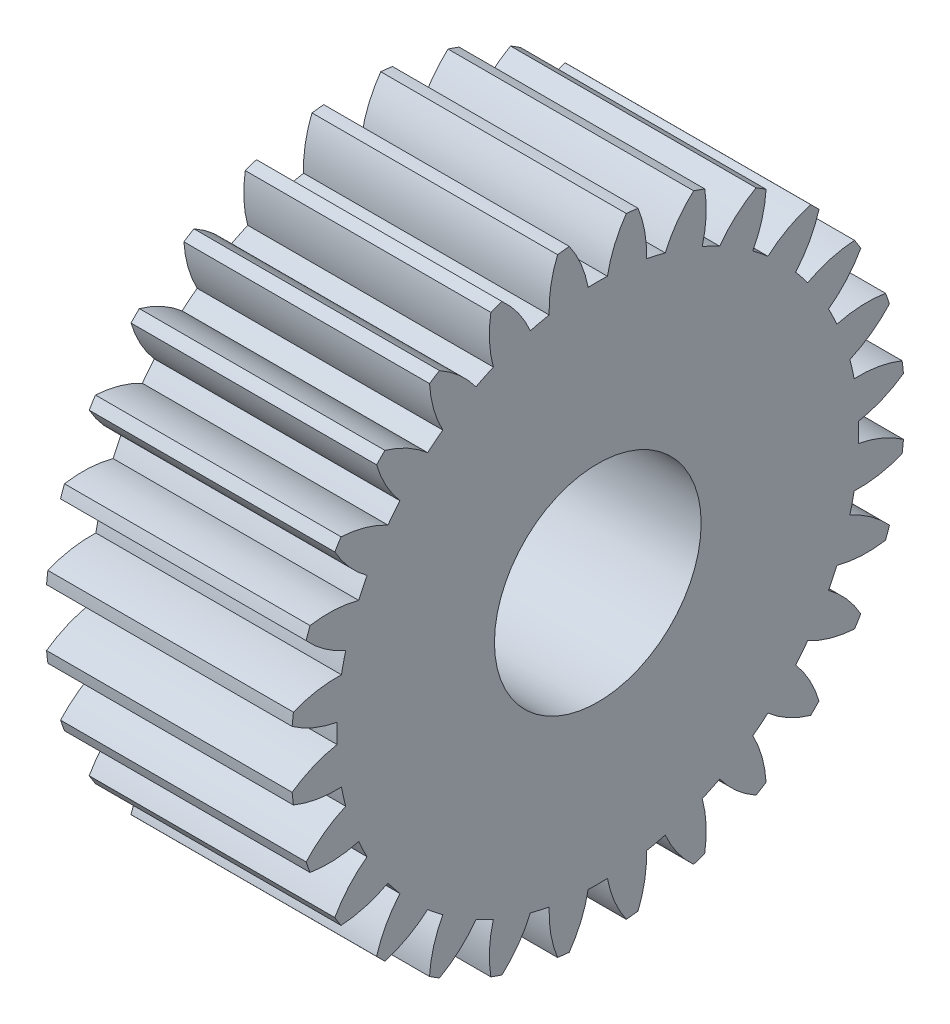
from build123d import *

# Parameters (mm, degrees)
SPUR_START             = -21.136062357
SPUR_GEAR_AM_OUTLINE_R = 1.5
SPUR_GEAR_AM_DEPTH     = 12
SKETCH1_R              = 5.05
CUT_EXTRUDE1_DEPTH     = 20


# Read off the part's stored shape, not the designer's step: spur gear_am
with BuildPart() as part:
    # spur gear_am outline → spur gear_am (new body)
    with BuildSketch(Plane.YZ.offset(SPUR_START)):
        with BuildLine():
            ThreePointArc((13.80407966, 17.98086417), (13.518158302, 18.015863136), (13.231617587, 18.045365155))
            ThreePointArc((13.231617587, 18.045365155), (12.652844511, 16.997451013), (12.310027199, 15.85046426))
            ThreePointArc((12.310027199, 15.85046426), (11.83869116, 15.859179988), (11.367355122, 15.85046426))
            ThreePointArc((11.367355122, 15.85046426), (11.02453781, 16.997451013), (10.445764734, 18.045365155))
            ThreePointArc((10.445764734, 18.045365155), (10.159224019, 18.015863136), (9.873302662, 17.98086417))
            ThreePointArc((9.873302662, 17.98086417), (9.542223468, 16.830434298), (9.463229866, 15.635920869))
            ThreePointArc((9.463229866, 15.635920869), (9.001771774, 15.53953594), (8.544192545, 15.426156598))
            ThreePointArc((8.544192545, 15.426156598), (7.954741816, 16.468101971), (7.157296955, 17.360953591))
            ThreePointArc((7.157296955, 17.360953591), (6.884505231, 17.268429942), (6.613540522, 17.170684986))
            ThreePointArc((6.613540522, 17.170684986), (6.546756904, 15.975426742), (6.73554808, 14.793284528))
            ThreePointArc((6.73554808, 14.793284528), (6.30710737, 14.596632085), (5.886229886, 14.384274442))
            ThreePointArc((5.886229886, 14.384274442), (5.07970326, 15.268930942), (4.10357383, 15.961948733))
            ThreePointArc((4.10357383, 15.961948733), (3.858210013, 15.811042976), (3.615789253, 15.655453369))
            ThreePointArc((3.615789253, 15.655453369), (3.816650021, 14.475301992), (4.263759198, 13.364808541))
            ThreePointArc((4.263759198, 13.364808541), (3.889819677, 13.077749558), (3.52674849, 12.777062114))
            ThreePointArc((3.52674849, 12.777062114), (2.54358858, 13.46006937), (1.437721787, 13.918502526))
            ThreePointArc((1.437721787, 13.918502526), (1.232089443, 13.716781705), (1.030368622, 13.511149361))
            ThreePointArc((1.030368622, 13.511149361), (1.488801778, 12.405282568), (2.171809034, 11.422122658))
            ThreePointArc((2.171809034, 11.422122658), (1.87112159, 11.059051471), (1.584062607, 10.68511195))
            ThreePointArc((1.584062607, 10.68511195), (0.473569156, 11.132221127), (-0.706582221, 11.333081895))
            ThreePointArc((-0.706582221, 11.333081895), (-0.862171828, 11.090661135), (-1.013077585, 10.845297318))
            ThreePointArc((-1.013077585, 10.845297318), (-0.320059794, 9.869167889), (0.564596706, 9.062641262))
            ThreePointArc((0.564596706, 9.062641262), (0.352239064, 8.641763777), (0.15558662, 8.213323068))
            ThreePointArc((0.15558662, 8.213323068), (-1.026555594, 8.402114244), (-2.221813838, 8.335330626))
            ThreePointArc((-2.221813838, 8.335330626), (-2.319558794, 8.064365917), (-2.412082443, 7.791574193))
            ThreePointArc((-2.412082443, 7.791574193), (-1.519230823, 6.994129332), (-0.47728545, 6.404678603))
            ThreePointArc((-0.47728545, 6.404678603), (-0.590664792, 5.947099374), (-0.687049721, 5.485641282))
            ThreePointArc((-0.687049721, 5.485641282), (-1.88156315, 5.406647681), (-3.031993022, 5.075568487))
            ThreePointArc((-3.031993022, 5.075568487), (-3.066991988, 4.78964713), (-3.096494006, 4.503106415))
            ThreePointArc((-3.096494006, 4.503106415), (-2.048579865, 3.924333338), (-0.901593112, 3.581516027))
            ThreePointArc((-0.901593112, 3.581516027), (-0.910308839, 3.110179988), (-0.901593112, 2.638843949))
            ThreePointArc((-0.901593112, 2.638843949), (-2.048579865, 2.296026638), (-3.096494006, 1.717253561))
            ThreePointArc((-3.096494006, 1.717253561), (-3.066991988, 1.430712846), (-3.031993022, 1.144791489))
            ThreePointArc((-3.031993022, 1.144791489), (-1.88156315, 0.813712295), (-0.687049721, 0.734718693))
            ThreePointArc((-0.687049721, 0.734718693), (-0.590664792, 0.273260601), (-0.47728545, -0.184318628))
            ThreePointArc((-0.47728545, -0.184318628), (-1.519230823, -0.773769357), (-2.412082443, -1.571214218))
            ThreePointArc((-2.412082443, -1.571214218), (-2.319558794, -1.844005942), (-2.221813838, -2.114970651))
            ThreePointArc((-2.221813838, -2.114970651), (-1.026555594, -2.181754269), (0.15558662, -1.992963092))
            ThreePointArc((0.15558662, -1.992963092), (0.352239064, -2.421403802), (0.564596706, -2.842281287))
            ThreePointArc((0.564596706, -2.842281287), (-0.320059794, -3.648807913), (-1.013077585, -4.624937343))
            ThreePointArc((-1.013077585, -4.624937343), (-0.862171828, -4.87030116), (-0.706582221, -5.11272192))
            ThreePointArc((-0.706582221, -5.11272192), (0.473569156, -4.911861152), (1.584062607, -4.464751975))
            ThreePointArc((1.584062607, -4.464751975), (1.871121591, -4.838691496), (2.171809034, -5.201762683))
            ThreePointArc((2.171809034, -5.201762683), (1.488801778, -6.184922593), (1.030368622, -7.290789386))
            ThreePointArc((1.030368622, -7.290789386), (1.232089443, -7.49642173), (1.437721787, -7.69814255))
            ThreePointArc((1.437721787, -7.69814255), (2.54358858, -7.239709395), (3.52674849, -6.556702139))
            ThreePointArc((3.52674849, -6.556702139), (3.889819677, -6.857389582), (4.263759198, -7.144448565))
            ThreePointArc((4.263759198, -7.144448565), (3.816650021, -8.254942017), (3.615789253, -9.435093394))
            ThreePointArc((3.615789253, -9.435093394), (3.858210013, -9.590683001), (4.10357383, -9.741588758))
            ThreePointArc((4.10357383, -9.741588758), (5.07970326, -9.048570967), (5.886229886, -8.163914467))
            ThreePointArc((5.886229886, -8.163914467), (6.307107371, -8.376272109), (6.73554808, -8.572924553))
            ThreePointArc((6.73554808, -8.572924553), (6.546756904, -9.755066766), (6.613540522, -10.95032501))
            ThreePointArc((6.613540522, -10.95032501), (6.884505231, -11.048069967), (7.157296955, -11.140593616))
            ThreePointArc((7.157296955, -11.140593616), (7.954741816, -10.247741996), (8.544192545, -9.205796623))
            ThreePointArc((8.544192545, -9.205796623), (9.001771774, -9.319175965), (9.463229866, -9.415560894))
            ThreePointArc((9.463229866, -9.415560894), (9.542223468, -10.610074323), (9.873302662, -11.760504195))
            ThreePointArc((9.873302662, -11.760504195), (10.159224019, -11.795503161), (10.445764734, -11.825005179))
            ThreePointArc((10.445764734, -11.825005179), (11.02453781, -10.777091038), (11.367355122, -9.630104285))
            ThreePointArc((11.367355122, -9.630104285), (11.83869116, -9.638820012), (12.310027199, -9.630104285))
            ThreePointArc((12.310027199, -9.630104285), (12.652844511, -10.777091038), (13.231617587, -11.825005179))
            ThreePointArc((13.231617587, -11.825005179), (13.518158302, -11.795503161), (13.80407966, -11.760504195))
            ThreePointArc((13.80407966, -11.760504195), (14.135158854, -10.610074323), (14.214152455, -9.415560894))
            ThreePointArc((14.214152455, -9.415560894), (14.675610547, -9.319175965), (15.133189776, -9.205796623))
            ThreePointArc((15.133189776, -9.205796623), (15.722640505, -10.247741996), (16.520085366, -11.140593616))
            ThreePointArc((16.520085366, -11.140593616), (16.79287709, -11.048069967), (17.063841799, -10.95032501))
            ThreePointArc((17.063841799, -10.95032501), (17.130625417, -9.755066766), (16.941834241, -8.572924553))
            ThreePointArc((16.941834241, -8.572924553), (17.37027495, -8.376272109), (17.791152435, -8.163914467))
            ThreePointArc((17.791152435, -8.163914467), (18.597679061, -9.048570967), (19.573808491, -9.741588758))
            ThreePointArc((19.573808491, -9.741588758), (19.819172308, -9.590683001), (20.061593068, -9.435093394))
            ThreePointArc((20.061593068, -9.435093394), (19.8607323, -8.254942017), (19.413623123, -7.144448565))
            ThreePointArc((19.413623123, -7.144448565), (19.787562644, -6.857389582), (20.150633831, -6.556702139))
            ThreePointArc((20.150633831, -6.556702139), (21.133793741, -7.239709395), (22.239660534, -7.69814255))
            ThreePointArc((22.239660534, -7.69814255), (22.445292878, -7.49642173), (22.647013699, -7.290789386))
            ThreePointArc((22.647013699, -7.290789386), (22.188580543, -6.184922593), (21.505573287, -5.201762683))
            ThreePointArc((21.505573287, -5.201762683), (21.806260731, -4.838691496), (22.093319714, -4.464751975))
            ThreePointArc((22.093319714, -4.464751975), (23.203813165, -4.911861152), (24.383964542, -5.11272192))
            ThreePointArc((24.383964542, -5.11272192), (24.539554149, -4.87030116), (24.690459906, -4.624937343))
            ThreePointArc((24.690459906, -4.624937343), (23.997442115, -3.648807913), (23.112785615, -2.842281287))
            ThreePointArc((23.112785615, -2.842281287), (23.325143257, -2.421403802), (23.521795701, -1.992963092))
            ThreePointArc((23.521795701, -1.992963092), (24.703937915, -2.181754269), (25.899196159, -2.114970651))
            ThreePointArc((25.899196159, -2.114970651), (25.996941115, -1.844005942), (26.089464764, -1.571214218))
            ThreePointArc((26.089464764, -1.571214218), (25.196613144, -0.773769357), (24.154667771, -0.184318628))
            ThreePointArc((24.154667771, -0.184318628), (24.268047113, 0.273260601), (24.364432042, 0.734718693))
            ThreePointArc((24.364432042, 0.734718693), (25.558945471, 0.813712295), (26.709375343, 1.144791489))
            ThreePointArc((26.709375343, 1.144791489), (26.744374309, 1.430712846), (26.773876327, 1.717253561))
            ThreePointArc((26.773876327, 1.717253561), (25.725962186, 2.296026638), (24.578975433, 2.638843949))
            ThreePointArc((24.578975433, 2.638843949), (24.587691161, 3.110179988), (24.578975433, 3.581516027))
            ThreePointArc((24.578975433, 3.581516027), (25.725962186, 3.924333338), (26.773876327, 4.503106415))
            ThreePointArc((26.773876327, 4.503106415), (26.744374309, 4.78964713), (26.709375343, 5.075568487))
            ThreePointArc((26.709375343, 5.075568487), (25.558945471, 5.406647681), (24.364432042, 5.485641282))
            ThreePointArc((24.364432042, 5.485641282), (24.268047113, 5.947099374), (24.154667771, 6.404678603))
            ThreePointArc((24.154667771, 6.404678603), (25.196613144, 6.994129332), (26.089464764, 7.791574193))
            ThreePointArc((26.089464764, 7.791574193), (25.996941115, 8.064365917), (25.899196159, 8.335330626))
            ThreePointArc((25.899196159, 8.335330626), (24.703937915, 8.402114244), (23.521795701, 8.213323068))
            ThreePointArc((23.521795701, 8.213323068), (23.325143257, 8.641763777), (23.112785615, 9.062641262))
            ThreePointArc((23.112785615, 9.062641262), (23.997442115, 9.869167889), (24.690459906, 10.845297318))
            ThreePointArc((24.690459906, 10.845297318), (24.539554149, 11.090661135), (24.383964542, 11.333081895))
            ThreePointArc((24.383964542, 11.333081895), (23.203813165, 11.132221127), (22.093319714, 10.68511195))
            ThreePointArc((22.093319714, 10.68511195), (21.806260731, 11.059051472), (21.505573287, 11.422122658))
            ThreePointArc((21.505573287, 11.422122658), (22.188580543, 12.405282568), (22.647013699, 13.511149361))
            ThreePointArc((22.647013699, 13.511149361), (22.445292878, 13.716781705), (22.239660534, 13.918502526))
            ThreePointArc((22.239660534, 13.918502526), (21.133793741, 13.46006937), (20.150633831, 12.777062114))
            ThreePointArc((20.150633831, 12.777062114), (19.787562644, 13.077749558), (19.413623123, 13.364808541))
            ThreePointArc((19.413623123, 13.364808541), (19.8607323, 14.475301992), (20.061593068, 15.655453369))
            ThreePointArc((20.061593068, 15.655453369), (19.819172308, 15.811042976), (19.573808491, 15.961948733))
            ThreePointArc((19.573808491, 15.961948733), (18.597679061, 15.268930942), (17.791152435, 14.384274442))
            ThreePointArc((17.791152435, 14.384274442), (17.370274951, 14.596632085), (16.941834241, 14.793284528))
            ThreePointArc((16.941834241, 14.793284528), (17.130625417, 15.975426742), (17.063841799, 17.170684986))
            ThreePointArc((17.063841799, 17.170684986), (16.79287709, 17.268429942), (16.520085366, 17.360953591))
            ThreePointArc((16.520085366, 17.360953591), (15.722640505, 16.468101971), (15.133189776, 15.426156598))
            ThreePointArc((15.133189776, 15.426156598), (14.675610547, 15.53953594), (14.214152455, 15.635920869))
            ThreePointArc((14.214152455, 15.635920869), (14.135158854, 16.830434298), (13.80407966, 17.98086417))
        make_face()
        with Locations((11.838691161, 3.110179988)):
            Circle(SPUR_GEAR_AM_OUTLINE_R, mode=Mode.SUBTRACT)
    extrude(amount=SPUR_GEAR_AM_DEPTH)

    # Sketch1 → Cut-Extrude1 (cut)
    with BuildSketch(Plane(origin=(-9.136062357, 0, 0), x_dir=(0, 0, -1), z_dir=(1, 0, 0))):
        with Locations((-3.110179988, 11.838691161)):
            Circle(SKETCH1_R)
    extrude(amount=-CUT_EXTRUDE1_DEPTH, mode=Mode.SUBTRACT)


solid = part.part
